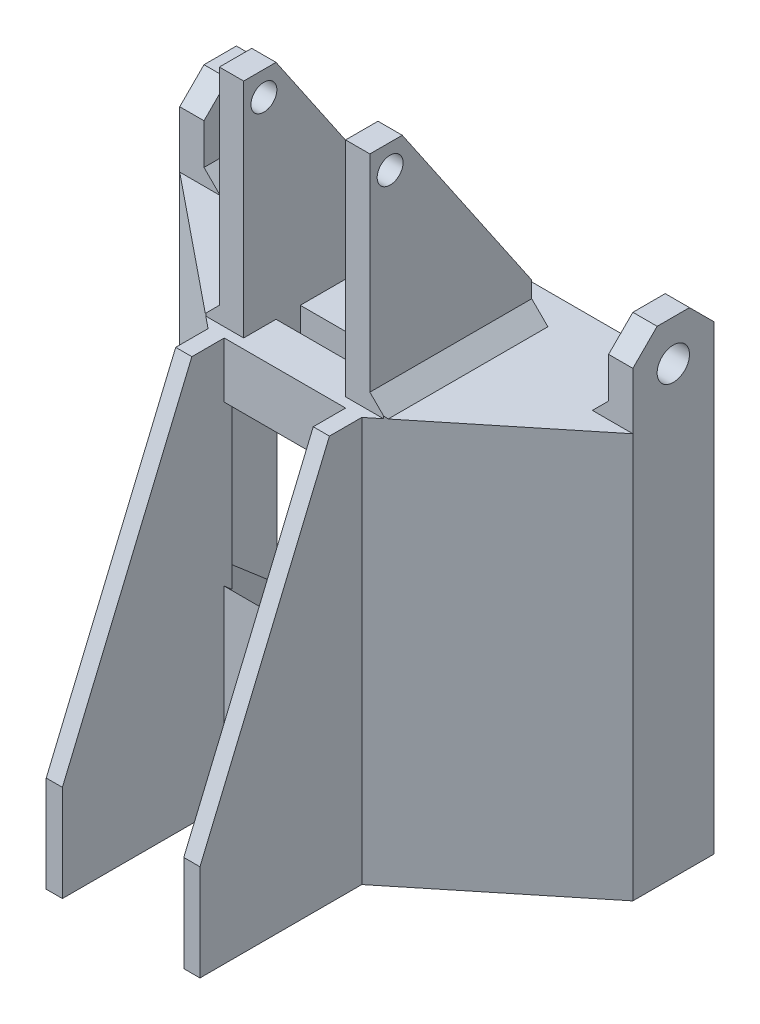
from build123d import *

# Parameters (mm, degrees)
SALIENTE_EXTRUIR1_DEPTH   = 45
SALIENTE_EXTRUIR1_2_DEPTH = 45
SALIENTE_EXTRUIR2_DEPTH   = 3
SALIENTE_EXTRUIR3_START   = -45
SALIENTE_EXTRUIR3_DEPTH   = 2
CROQUIS4_W                = 3
CROQUIS4_H                = 10
SALIENTE_EXTRUIR4_DEPTH   = 10
CROQUIS5_R                = 2
CORTAR_EXTRUIR1_DEPTH     = 87.967390625
CHAFL_N1_SIZE             = 3
CORTAR_EXTRUIR3_DEPTH     = 77.377856949
SALIENTE_EXTRUIR7_DEPTH   = 54
CROQUIS6_W                = 15
CROQUIS6_H                = 20
CORTAR_EXTRUIR5_DEPTH     = 74.806009458
CORTAR_EXTRUIR6_DEPTH     = 74.806009458
CORTAR_EXTRUIR7_DEPTH     = 77.377856949
CROQUIS16_W               = 12.6
CROQUIS16_H               = 3
CORTAR_EXTRUIR8_DEPTH     = 5
CROQUIS18_W               = 3
CROQUIS18_H               = 20
SALIENTE_EXTRUIR8_DEPTH   = 27.5
CORTAR_EXTRUIR9_REACH     = 90.622
CROQUIS21_W               = 4
CROQUIS21_H               = 10
CORTAR_EXTRUIR10_DEPTH    = 3
CROQUIS22_R               = 1.6
CORTAR_EXTRUIR11_DEPTH    = 89.621555367
CHAFL_N2_SIZE             = 2


with BuildPart() as part:
    # Croquis1 → Saliente-Extruir1 (new body)
    with BuildSketch(Plane(origin=(0, 0, 0), x_dir=(1, 0, 0), z_dir=(0, 1, 0))):
        Polygon((-26, 17.391304348), (-26, 8.344494697), (-7.5, -6.655505303), (-7.5, -32.608695652), (-9.5, -32.608695652), (-9.5, -7.608695652), (-28, 7.391304348), (-28, 17.391304348), align=None)
    extrude(amount=SALIENTE_EXTRUIR1_DEPTH)



with BuildPart() as body_2:
    # Croquis1 → Saliente-Extruir1 2 (new body)
    with BuildSketch(Plane(origin=(0, 0, 0), x_dir=(1, 0, 0), z_dir=(0, 1, 0))):
        Polygon((7.5, -6.655505303), (7.5, -32.608695652), (9.5, -32.608695652), (9.5, -7.608695652), (28, 7.391304348), (28, 17.391304348), (26, 17.391304348), (26, 8.344494697), align=None)
    extrude(amount=SALIENTE_EXTRUIR1_2_DEPTH)


with BuildPart() as part_1:
    add(part.part)

    add(body_2.part)  # Saliente-Extruir2 merges body 2
    # Croquis2 → Saliente-Extruir2 (add)
    with BuildSketch(Plane(origin=(0, 45, 0), x_dir=(1, 0, 0), z_dir=(0, 1, 0))):
        Polygon((-9.5, -32.608695652), (9.5, -32.608695652), (9.5, -7.608695652), (28, 7.391304348), (28, 17.391304348), (-28, 17.391304348), (-28, 7.391304348), (-9.5, -7.608695652), align=None)
    extrude(amount=SALIENTE_EXTRUIR2_DEPTH)

    # Croquis2<2> → Saliente-Extruir3 (add)
    with BuildSketch(Plane(origin=(0, 45, 0), x_dir=(1, 0, 0), z_dir=(0, 1, 0)).offset(SALIENTE_EXTRUIR3_START)):
        Polygon((-9.5, -32.608695652), (9.5, -32.608695652), (9.5, -7.608695652), (28, 7.391304348), (28, 17.391304348), (-28, 17.391304348), (-28, 7.391304348), (-9.5, -7.608695652), align=None)
    extrude(amount=-SALIENTE_EXTRUIR3_DEPTH)

    # Croquis4 → Saliente-Extruir4 (add)
    with BuildSketch(Plane(origin=(0, 48, 0), x_dir=(1, 0, 0), z_dir=(0, 1, 0))):
        with Locations((-26.5, 12.391304348)):
            Rectangle(CROQUIS4_W, CROQUIS4_H)
        with Locations((26.5, 12.391304348)):
            Rectangle(CROQUIS4_W, CROQUIS4_H)
    extrude(amount=SALIENTE_EXTRUIR4_DEPTH)

    # Croquis5 → Cortar-Extruir1 (cut, through all)
    with BuildSketch(Plane(origin=(28, 0, 0), x_dir=(0, 0, -1), z_dir=(1, 0, 0))):
        with Locations((12.391304348, 53)):
            Circle(CROQUIS5_R)
    extrude(amount=-CORTAR_EXTRUIR1_DEPTH, mode=Mode.SUBTRACT)

    # Chaflán1
    chafl_n1_edges = [part_1.edges().sort_by_distance(p)[0] for p in [
        (-26.5, 58, -7.391304348),
        (-26.5, 58, -17.391304348),
        (26.5, 58, -17.391304348),
        (26.5, 58, -7.391304348),
    ]]
    chamfer(chafl_n1_edges, length=CHAFL_N1_SIZE)

    # Croquis7 → Cortar-Extruir3 (cut, through all)
    with BuildSketch(Plane(origin=(9.5, 0, 0), x_dir=(0, 0, -1), z_dir=(1, 0, 0))):
        Polygon((-32.608695652, -2), (-11.608695652, 48), (-32.608695652, 48), align=None)
    extrude(amount=-CORTAR_EXTRUIR3_DEPTH, mode=Mode.SUBTRACT)

    # Croquis13 → Saliente-Extruir7 (add)
    with BuildSketch(Plane(origin=(-26, 0, 0), x_dir=(0, 0, -1), z_dir=(1, 0, 0))):
        Polygon((17.391304348, 45), (-12.868695652, 45), (-14.968695652, 40), align=None)
        Polygon((17.391304348, 0), (-31.768695652, 0), (-18.748695652, 31), align=None)
    extrude(amount=SALIENTE_EXTRUIR7_DEPTH)

    # Croquis6 → Cortar-Extruir5 (cut, through all)
    with BuildSketch(Plane.XZ.offset(2)):
        with Locations((0, 17.608695652)):
            Rectangle(CROQUIS6_W, CROQUIS6_H)
    extrude(amount=-CORTAR_EXTRUIR5_DEPTH, mode=Mode.SUBTRACT)

    # Croquis14 → Cortar-Extruir6 (cut, through all)
    with BuildSketch(Plane.XZ.offset(2)):
        Polygon((-28, -7.391304348), (-9.5, 7.608695652), (-9.5, 32.608695652), (-28, 32.608695652), align=None)
        Polygon((28, -7.391304348), (9.5, 7.608695652), (9.5, 32.608695652), (28, 32.608695652), align=None)
    extrude(amount=-CORTAR_EXTRUIR6_DEPTH, mode=Mode.SUBTRACT)

    # Croquis15 → Cortar-Extruir7 (cut, through all)
    with BuildSketch(Plane(origin=(9.5, 0, 0), x_dir=(0, 0, -1), z_dir=(1, 0, 0))):
        Polygon((-27.608695652, -2), (-27.608695652, 9.904761905), (-32.608695652, -2), align=None)
    extrude(amount=-CORTAR_EXTRUIR7_DEPTH, mode=Mode.SUBTRACT)

    # Croquis16 → Cortar-Extruir8 (cut)
    with BuildSketch(Plane(origin=(0, 48, 0), x_dir=(1, 0, 0), z_dir=(0, 1, 0))):
        with Locations((0, -0.908695652)):
            Rectangle(CROQUIS16_W, CROQUIS16_H)
    extrude(amount=-CORTAR_EXTRUIR8_DEPTH, mode=Mode.SUBTRACT)

    # Croquis18 → Saliente-Extruir8 (add)
    with BuildSketch(Plane(origin=(0, 48, 0), x_dir=(1, 0, 0), z_dir=(0, 1, 0))):
        with Locations((-7.8, 3.591304348)):
            Rectangle(CROQUIS18_W, CROQUIS18_H)
        with Locations((7.8, 3.591304348)):
            Rectangle(CROQUIS18_W, CROQUIS18_H)
    extrude(amount=SALIENTE_EXTRUIR8_DEPTH)

    # Cortar-Extruir9: up to this face of the body (flat: up to its plane)
    cortar_extruir9_end = Plane(part_1.part.faces().sort_by_distance((9.3, 61.75, -3.591304348))[0])
    # Croquis20 → Cortar-Extruir9 (cut, up to the picked face)
    with BuildSketch(Plane.ZY.offset(9.3), mode=Mode.PRIVATE) as cortar_extruir9_sk1:
        Polygon((2.408695652, 75.5), (-13.591304348, 52), (-13.591304348, 75.5), align=None)
    cortar_extruir9_tool1 = split(extrude(cortar_extruir9_sk1.sketch, amount=-CORTAR_EXTRUIR9_REACH, mode=Mode.PRIVATE), bisect_by=cortar_extruir9_end, keep=Keep.BOTH, mode=Mode.PRIVATE)
    add(cortar_extruir9_tool1.solids().sort_by(Axis((-9.3, 67.666667, -8.257971), (1, 0, 0)))[0], mode=Mode.SUBTRACT)

    # Croquis21 → Cortar-Extruir10 (cut)
    with BuildSketch(Plane(origin=(0, 48, 0), x_dir=(1, 0, 0), z_dir=(0, 1, 0))):
        with Locations((0, 14.771116856)):
            Rectangle(CROQUIS21_W, CROQUIS21_H)
    extrude(amount=-CORTAR_EXTRUIR10_DEPTH, mode=Mode.SUBTRACT)

    # Croquis22 → Cortar-Extruir11 (cut, through all)
    with BuildSketch(Plane(origin=(9.3, 0, 0), x_dir=(0, 0, -1), z_dir=(1, 0, 0))):
        with Locations((-3.908695652, 72.518591358)):
            Circle(CROQUIS22_R)
    extrude(amount=-CORTAR_EXTRUIR11_DEPTH, mode=Mode.SUBTRACT)

    # Chaflán2
    # the kernel refuses this chamfer: 2 mm, written as the material it adds along each edge
    with BuildSketch(Plane(origin=(-25, 48, -17.391304348), x_dir=(0.9996219169112968, -0.027495876610585647, 0), z_dir=(0, 0, 1)), Plane(origin=(25, 48, -17.391304348), x_dir=(0.027495876610585647, 0.9996219169112968, 0), z_dir=(0, 0, 1))) as chafl_n2_piece_1:
        Polygon((CHAFL_N2_SIZE * 0.999621916911, CHAFL_N2_SIZE * 0.0274958766106), (-CHAFL_N2_SIZE * 0.0274958766106, CHAFL_N2_SIZE * 0.999621916911), (0, 0), align=None)
    extrude(amount=10)
    with BuildSketch(Plane(origin=(-9.3, 48, 6.408695652), x_dir=(-0.9996219169112968, -0.027495876610585623, 0), z_dir=(0, 0, -1))) as chafl_n2_piece_2_section:
        Polygon((CHAFL_N2_SIZE * 0.999621916911, CHAFL_N2_SIZE * 0.0274958766106), (-CHAFL_N2_SIZE * 0.0274958766106, CHAFL_N2_SIZE * 0.999621916911), (0, 0), align=None)
    chafl_n2_piece_2 = extrude(amount=20, mode=Mode.PRIVATE)
    chafl_n2_piece_2 = split(chafl_n2_piece_2, bisect_by=Plane(origin=(-15.34165394, 48.600071078, 2.872219484), z_dir=(0.6298019584212193, 0, -0.7767557487195037)), keep=Keep.TOP, mode=Mode.PRIVATE)
    add(chafl_n2_piece_2)
    with BuildSketch(Plane(origin=(9.3, 48, 6.408695652), x_dir=(0.9996219169112968, -0.027495876610585623, 0), z_dir=(0, 0, -1))) as chafl_n2_piece_3_section:
        Polygon((CHAFL_N2_SIZE * 0.999621916911, -CHAFL_N2_SIZE * 0.0274958766106), (-CHAFL_N2_SIZE * 0.0274958766106, -CHAFL_N2_SIZE * 0.999621916911), (0, 0), align=None)
    chafl_n2_piece_3 = extrude(amount=20, mode=Mode.PRIVATE)
    chafl_n2_piece_3 = split(chafl_n2_piece_3, bisect_by=Plane(origin=(15.34165394, 48.600071078, 2.872219484), z_dir=(-0.6298019584212193, 0, -0.7767557487195037)), keep=Keep.TOP, mode=Mode.PRIVATE)
    add(chafl_n2_piece_3)


solid = part_1.part
